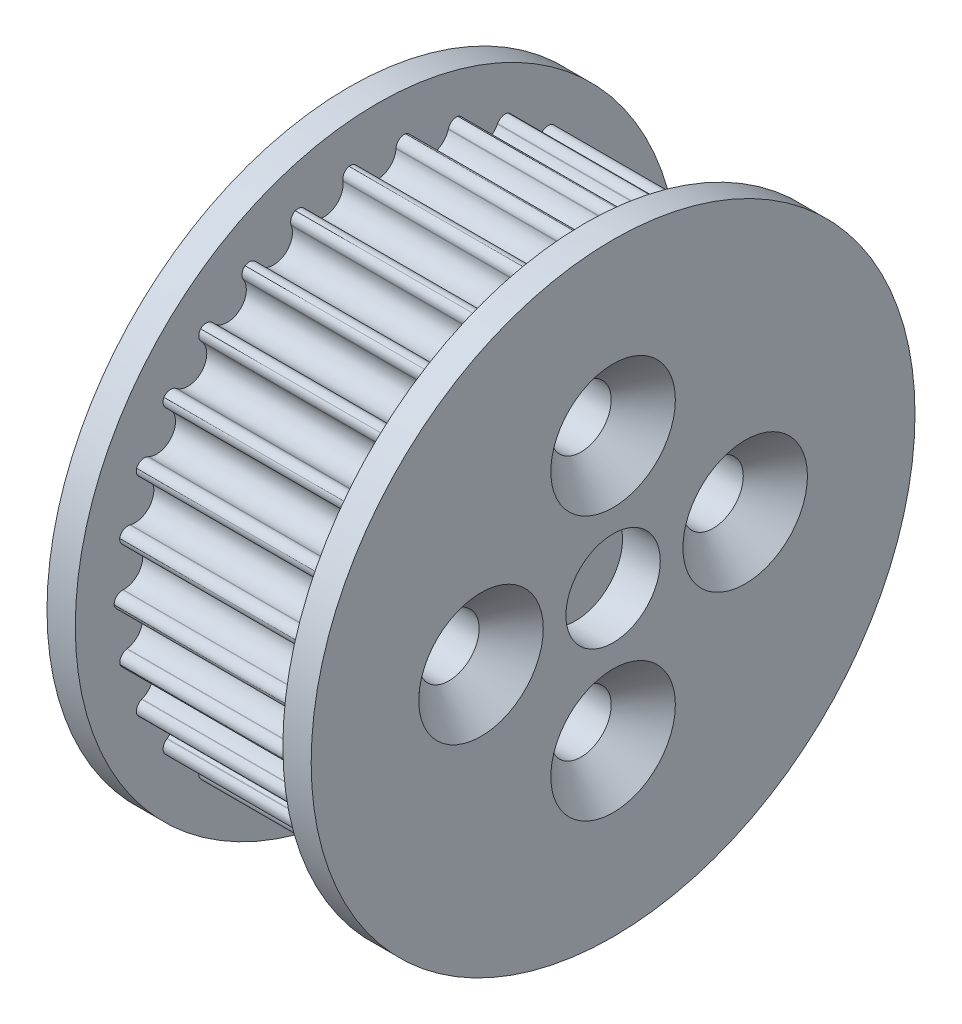
from build123d import *

# Parameters (mm, degrees)
SKETCH_1_R                     = 16
EXTRUDE_1_DEPTH                = 1.5
SKETCH_2_R                     = 13.945
EXTRUDE_2_DEPTH                = 11
CUT_EXTRUDE_START              = -11
CUT_EXTRUDE_1_DEPTH            = 11
FILLET_1_R                     = 0.45
PATTERN_START                  = 1.5
PATTERN_CIRCULAR_1_DEPTH       = 11
SKETCH_4_R                     = 16
EXTRUDE_3_DEPTH                = 1.5
HOLE_WIZARD_M3_1_D             = 3.2
SKETCH_7_R                     = 3
CUT_EXTRUDE_2_DEPTH            = 4
SKETCH_8_R                     = 2.5
CUT_EXTRUDE_3_DEPTH            = 2
HOLE_WIZARD_M3_1_2_D           = 3.2
HOLE_WIZARD_M3_1_2_CSINK_D     = 6.6
HOLE_WIZARD_M3_1_2_CSINK_ANGLE = 90


# Read off the part's stored shape, not the designer's step: 阵列(圆周)1
with BuildPart() as part:
    # 草图1 → 凸台-拉伸1 (new body)
    with BuildSketch(Plane(origin=(0, 0, 0), x_dir=(0, 0, -1), z_dir=(1, 0, 0))):
        Circle(SKETCH_1_R)
    extrude(amount=EXTRUDE_1_DEPTH)

    # 草图2 → 凸台-拉伸2 (add)
    with BuildSketch(Plane(origin=(1.5, 0, 0), x_dir=(0, 0, -1), z_dir=(1, 0, 0))):
        Circle(SKETCH_2_R)
    extrude(amount=EXTRUDE_2_DEPTH)

    # 草图3 → 切除-拉伸1 (cut)
    with BuildSketch(Plane(origin=(12.5, 0, 0), x_dir=(0, 0, -1), z_dir=(1, 0, 0)).offset(CUT_EXTRUDE_START)):
        with BuildLine():
            Line((-0.997252742, 13.425925926), (-1.032962963, 13.906689488))
            ThreePointArc((-1.032962963, 13.906689488), (0, 13.945), (1.032962963, 13.906689488))
            Line((1.032962963, 13.906689488), (0.997252742, 13.425925926))
            ThreePointArc((0.997252742, 13.425925926), (0, 12.5), (-0.997252742, 13.425925926))
        make_face()
    extrude(amount=CUT_EXTRUDE_1_DEPTH, mode=Mode.SUBTRACT)

    # 圆角1
    fillet_1_edges = [part.edges().sort_by_distance(p)[0] for p in [
        (7, 13.906689488, 1.032962963),
        (7, 13.906689488, -1.032962963),
    ]]
    fillet(fillet_1_edges, radius=FILLET_1_R)

    # 阵列(圆周)1 outline → 阵列(圆周)1 (cut)
    with BuildSketch(Plane.YZ.offset(PATTERN_START)):
        with BuildLine():
            Line((12.948797983, 3.773745592), (12.925196728, 3.766867337))
            ThreePointArc((12.925196728, 3.766867337), (12.226845009, 2.598896135), (13.339877736, 1.815946583))
            Line((13.339877736, 1.815946583), (13.37062966, 1.820132817))
            ThreePointArc((13.37062966, 1.820132817), (13.678173697, 1.750499408), (13.864510817, 1.496116577))
            ThreePointArc((13.864510817, 1.496116577), (13.632172809, 2.937156703), (13.250477864, 4.346016726))
            ThreePointArc((13.250477864, 4.346016726), (13.220964034, 3.995922584), (12.948797983, 3.773745592))
        make_face()
        with BuildLine():
            ThreePointArc((12.954992704, -3.775550956), (13.207625703, -3.96425367), (13.274386313, -4.272434084))
            ThreePointArc((13.274386313, -4.272434084), (13.640268293, -2.899328528), (13.864510817, -1.496116577))
            ThreePointArc((13.864510817, -1.496116577), (13.678173697, -1.750499408), (13.37062966, -1.820132817))
            Line((13.37062966, -1.820132817), (13.339877736, -1.815946583))
            ThreePointArc((13.339877736, -1.815946583), (12.226845009, -2.598896135), (12.925196728, -3.766867337))
            Line((12.925196728, -3.766867337), (12.954992704, -3.775550956))
        make_face()
        with BuildLine():
            ThreePointArc((11.886913848, -6.386540547), (12.094792709, -6.623645008), (12.096020129, -6.938971252))
            ThreePointArc((12.096020129, -6.938971252), (12.755076867, -5.636580446), (13.274386314, -4.272434084))
            ThreePointArc((13.274386314, -4.272434084), (13.04472895, -4.538318402), (12.69394963, -4.558088173))
            Line((12.69394963, -4.558088173), (12.670812877, -4.549780329))
            ThreePointArc((12.670812877, -4.549780329), (11.419318221, -5.084208039), (11.859574412, -6.371851754))
            Line((11.859574412, -6.371851754), (11.886913848, -6.386540547))
        make_face()
        with BuildLine():
            ThreePointArc((10.299319817, -8.71840767), (10.453359237, -8.993551275), (10.388999822, -9.302242079))
            ThreePointArc((10.388999822, -9.302242079), (11.304436864, -8.165337237), (12.096020129, -6.938971252))
            ThreePointArc((12.096020129, -6.938971252), (11.816100872, -7.151296908), (11.468876555, -7.097703541))
            Line((11.468876555, -7.097703541), (11.447972694, -7.084766842))
            ThreePointArc((11.447972694, -7.084766842), (10.11271243, -7.347315654), (10.275631785, -8.698355674))
            Line((10.275631785, -8.698355674), (10.299319817, -8.71840767))
        make_face()
        with BuildLine():
            ThreePointArc((8.261596088, -10.669238542), (8.355063805, -10.970396196), (8.227930371, -11.25896029))
            ThreePointArc((8.227930371, -11.25896029), (9.359738725, -10.33722961), (10.388999822, -9.302242079))
            ThreePointArc((10.388999822, -9.302242079), (10.071052486, -9.451729424), (9.742558541, -9.327115206))
            Line((9.742558541, -9.327115206), (9.724801171, -9.310115047))
            ThreePointArc((9.724801171, -9.310115047), (8.364132579, -9.289310318), (8.242594741, -10.644699711))
            Line((8.242594741, -10.644699711), (8.261596088, -10.669238542))
        make_face()
        with BuildLine():
            ThreePointArc((5.862800967, -12.153772493), (5.891611993, -12.467782161), (5.707260881, -12.72360791))
            ThreePointArc((5.707260881, -12.72360791), (7.005975091, -12.057335445), (8.227930371, -11.25896029))
            ThreePointArc((8.227930371, -11.25896029), (7.88585078, -11.339076009), (7.590443969, -11.14888718))
            Line((7.590443969, -11.14888718), (7.576609172, -11.12856655))
            ThreePointArc((7.576609172, -11.12856655), (6.25, -10.825317547), (5.849316754, -12.125819292))
            Line((5.849316754, -12.125819292), (5.862800967, -12.153772493))
        make_face()
        with BuildLine():
            ThreePointArc((3.20777331, -13.107128265), (3.170668466, -13.420266218), (2.937156703, -13.632172809))
            ThreePointArc((2.937156703, -13.632172809), (4.346016726, -13.250477864), (5.707260881, -12.72360791))
            ThreePointArc((5.707260881, -12.72360791), (5.355999555, -12.730850562), (5.106590573, -12.483399285))
            Line((5.106590573, -12.483399285), (5.097282995, -12.460646294))
            ThreePointArc((5.097282995, -12.460646294), (3.86271243, -11.888206454), (3.200395558, -13.076982384))
            Line((3.200395558, -13.076982384), (3.20777331, -13.107128265))
        make_face()
        with BuildLine():
            ThreePointArc((0.412550568, -13.487639638), (0.311151512, -13.786220244), (0.038684684, -13.944946343))
            ThreePointArc((0.038684684, -13.944946343), (1.496116577, -13.864510817), (2.937156703, -13.632172809))
            ThreePointArc((2.937156703, -13.632172809), (2.592065448, -13.566225856), (2.399554664, -13.27232694))
            Line((2.399554664, -13.27232694), (2.395181092, -13.248136002))
            ThreePointArc((2.395181092, -13.248136002), (1.30660579, -12.431523692), (0.411601718, -13.456618596))
            Line((0.411601718, -13.456618596), (0.412550568, -13.487639638))
        make_face()
        with BuildLine():
            ThreePointArc((-2.400702614, -13.278676438), (-2.561964256, -13.549650292), (-2.861478041, -13.648258805))
            ThreePointArc((-2.861478041, -13.648258805), (-1.419171046, -13.872598118), (0.038684684, -13.944946343))
            ThreePointArc((0.038684684, -13.944946343), (-0.285154357, -13.808691982), (-0.412353298, -13.48119022))
            Line((-0.412353298, -13.48119022), (-0.411601718, -13.456618596))
            ThreePointArc((-0.411601718, -13.456618596), (-1.30660579, -12.431523692), (-2.395181092, -13.248136002))
            Line((-2.395181092, -13.248136002), (-2.400702614, -13.278676438))
        make_face()
        with BuildLine():
            ThreePointArc((-5.109033572, -12.489371359), (-5.323109893, -12.720895603), (-5.636580446, -12.755076867))
            ThreePointArc((-5.636580446, -12.755076867), (-4.272434084, -13.274386313), (-2.861478041, -13.648258806))
            ThreePointArc((-2.861478041, -13.648258806), (-3.149911548, -13.447652008), (-3.206239442, -13.100860798))
            Line((-3.206239442, -13.100860798), (-3.200395558, -13.076982384))
            ThreePointArc((-3.200395558, -13.076982384), (-3.86271243, -11.888206454), (-5.097282995, -12.460646294))
            Line((-5.097282995, -12.460646294), (-5.109033572, -12.489371359))
        make_face()
        with BuildLine():
            ThreePointArc((-7.594075247, -11.154220821), (-7.851610083, -11.336176735), (-8.165337237, -11.304436864))
            ThreePointArc((-8.165337237, -11.304436864), (-6.938971252, -12.096020129), (-5.636580446, -12.755076867))
            ThreePointArc((-5.636580446, -12.755076867), (-5.877002489, -12.498885111), (-5.859997537, -12.147960893))
            Line((-5.859997537, -12.147960893), (-5.849316754, -12.125819292))
            ThreePointArc((-5.849316754, -12.125819292), (-6.25, -10.825317547), (-7.576609172, -11.12856655))
            Line((-7.576609172, -11.12856655), (-7.594075247, -11.154220821))
        make_face()
        with BuildLine():
            ThreePointArc((-9.747219393, -9.331577309), (-10.036957237, -9.456012547), (-10.33722961, -9.359738725))
            ThreePointArc((-10.33722961, -9.359738725), (-9.302242079, -10.388999822), (-8.165337237, -11.304436864))
            ThreePointArc((-8.165337237, -11.304436864), (-8.347240221, -11.003856959), (-8.25764562, -10.664136806))
            Line((-8.25764562, -10.664136806), (-8.242594741, -10.644699711))
            ThreePointArc((-8.242594741, -10.644699711), (-8.364132579, -9.289310318), (-9.724801171, -9.310115047))
            Line((-9.724801171, -9.310115047), (-9.747219393, -9.331577309))
        make_face()
        with BuildLine():
            ThreePointArc((-11.47436328, -7.101099091), (-11.783641197, -7.162575236), (-12.057335445, -7.005975091))
            ThreePointArc((-12.057335445, -7.005975091), (-11.25896029, -8.227930371), (-10.33722961, -9.359738725))
            ThreePointArc((-10.33722961, -9.359738725), (-10.452663501, -9.027907455), (-10.294394966, -8.714238767))
            Line((-10.294394966, -8.714238767), (-10.275631785, -8.698355674))
            ThreePointArc((-10.275631785, -8.698355674), (-10.11271243, -7.347315654), (-11.447972694, -7.084766842))
            Line((-11.447972694, -7.084766842), (-11.47436328, -7.101099091))
        make_face()
        with BuildLine():
            ThreePointArc((-12.700022431, -4.560268768), (-13.015323493, -4.556099016), (-13.250477864, -4.346016726))
            ThreePointArc((-13.250477864, -4.346016726), (-12.72360791, -5.707260881), (-12.057335445, -7.005975091))
            ThreePointArc((-12.057335445, -7.005975091), (-12.101255228, -6.657395075), (-11.881229853, -6.383486679))
            Line((-11.881229853, -6.383486679), (-11.859574412, -6.371851754))
            ThreePointArc((-11.859574412, -6.371851754), (-11.419318221, -5.084208039), (-12.670812877, -4.549780329))
            Line((-12.670812877, -4.549780329), (-12.700022431, -4.560268768))
        make_face()
        with BuildLine():
            ThreePointArc((-13.37062966, -1.820132817), (-13.678173697, -1.750499408), (-13.864510817, -1.496116577))
            ThreePointArc((-13.864510817, -1.496116577), (-13.632172809, -2.937156703), (-13.250477864, -4.346016726))
            ThreePointArc((-13.250477864, -4.346016726), (-13.220964034, -3.995922584), (-12.948797983, -3.773745592))
            Line((-12.948797983, -3.773745592), (-12.925196728, -3.766867337))
            ThreePointArc((-12.925196728, -3.766867337), (-12.226845009, -2.598896135), (-13.339877736, -1.815946583))
            Line((-13.339877736, -1.815946583), (-13.37062966, -1.820132817))
        make_face()
        with BuildLine():
            ThreePointArc((-13.456876214, 0.999551672), (-13.743222076, 1.131605425), (-13.872598118, 1.419171046))
            ThreePointArc((-13.872598118, 1.419171046), (-13.944946343, -0.038684684), (-13.864510817, -1.496116577))
            ThreePointArc((-13.864510817, -1.496116577), (-13.76285327, -1.159809102), (-13.450441506, -0.999073714))
            Line((-13.450441506, -0.999073714), (-13.425925926, -0.997252742))
            ThreePointArc((-13.425925926, -0.997252742), (-12.5, 0), (-13.425925926, 0.997252742))
            Line((-13.425925926, 0.997252742), (-13.456876214, 0.999551672))
        make_face()
        with BuildLine():
            ThreePointArc((-12.954992704, 3.775550956), (-13.207625703, 3.96425367), (-13.274386313, 4.272434084))
            ThreePointArc((-13.274386313, 4.272434084), (-13.648258805, 2.861478041), (-13.872598118, 1.419171046))
            ThreePointArc((-13.872598118, 1.419171046), (-13.703239776, 1.726993604), (-13.364236193, 1.81926248))
            Line((-13.364236193, 1.81926248), (-13.339877736, 1.815946583))
            ThreePointArc((-13.339877736, 1.815946583), (-12.226845009, 2.598896135), (-12.925196728, 3.766867337))
            Line((-12.925196728, 3.766867337), (-12.954992704, 3.775550956))
        make_face()
        with BuildLine():
            ThreePointArc((-11.886913848, 6.386540547), (-12.094792709, 6.623645008), (-12.096020129, 6.938971252))
            ThreePointArc((-12.096020129, 6.938971252), (-12.755076867, 5.636580446), (-13.274386313, 4.272434084))
            ThreePointArc((-13.274386313, 4.272434084), (-13.04472895, 4.538318402), (-12.69394963, 4.558088173))
            Line((-12.69394963, 4.558088173), (-12.670812877, 4.549780329))
            ThreePointArc((-12.670812877, 4.549780329), (-11.419318221, 5.084208039), (-11.859574412, 6.371851754))
            Line((-11.859574412, 6.371851754), (-11.886913848, 6.386540547))
        make_face()
        with BuildLine():
            ThreePointArc((-10.299319817, 8.71840767), (-10.453359237, 8.993551275), (-10.388999822, 9.302242079))
            ThreePointArc((-10.388999822, 9.302242079), (-11.304436864, 8.165337237), (-12.096020129, 6.938971252))
            ThreePointArc((-12.096020129, 6.938971252), (-11.816100872, 7.151296908), (-11.468876555, 7.097703541))
            Line((-11.468876555, 7.097703541), (-11.447972694, 7.084766842))
            ThreePointArc((-11.447972694, 7.084766842), (-10.11271243, 7.347315654), (-10.275631785, 8.698355674))
            Line((-10.275631785, 8.698355674), (-10.299319817, 8.71840767))
        make_face()
        with BuildLine():
            ThreePointArc((-8.261596088, 10.669238542), (-8.355063805, 10.970396196), (-8.227930371, 11.25896029))
            ThreePointArc((-8.227930371, 11.25896029), (-9.359738725, 10.33722961), (-10.388999822, 9.302242079))
            ThreePointArc((-10.388999822, 9.302242079), (-10.071052486, 9.451729424), (-9.742558541, 9.327115206))
            Line((-9.742558541, 9.327115206), (-9.724801171, 9.310115047))
            ThreePointArc((-9.724801171, 9.310115047), (-8.364132579, 9.289310318), (-8.242594741, 10.644699711))
            Line((-8.242594741, 10.644699711), (-8.261596088, 10.669238542))
        make_face()
        with BuildLine():
            ThreePointArc((-5.862800967, 12.153772493), (-5.891611993, 12.467782161), (-5.707260881, 12.72360791))
            ThreePointArc((-5.707260881, 12.72360791), (-7.005975091, 12.057335445), (-8.227930371, 11.25896029))
            ThreePointArc((-8.227930371, 11.25896029), (-7.88585078, 11.339076009), (-7.590443969, 11.14888718))
            Line((-7.590443969, 11.14888718), (-7.576609172, 11.12856655))
            ThreePointArc((-7.576609172, 11.12856655), (-6.25, 10.825317547), (-5.849316754, 12.125819292))
            Line((-5.849316754, 12.125819292), (-5.862800967, 12.153772493))
        make_face()
        with BuildLine():
            ThreePointArc((-3.20777331, 13.107128265), (-3.170668466, 13.420266218), (-2.937156703, 13.632172809))
            ThreePointArc((-2.937156703, 13.632172809), (-4.346016726, 13.250477864), (-5.707260881, 12.72360791))
            ThreePointArc((-5.707260881, 12.72360791), (-5.355999555, 12.730850562), (-5.106590573, 12.483399285))
            Line((-5.106590573, 12.483399285), (-5.097282995, 12.460646294))
            ThreePointArc((-5.097282995, 12.460646294), (-3.86271243, 11.888206454), (-3.200395558, 13.076982384))
            Line((-3.200395558, 13.076982384), (-3.20777331, 13.107128265))
        make_face()
        with BuildLine():
            ThreePointArc((-0.412550568, 13.487639638), (-0.311151512, 13.786220244), (-0.038684684, 13.944946343))
            ThreePointArc((-0.038684684, 13.944946343), (-1.496116577, 13.864510817), (-2.937156703, 13.632172809))
            ThreePointArc((-2.937156703, 13.632172809), (-2.592065448, 13.566225856), (-2.399554664, 13.27232694))
            Line((-2.399554664, 13.27232694), (-2.395181092, 13.248136002))
            ThreePointArc((-2.395181092, 13.248136002), (-1.30660579, 12.431523692), (-0.411601718, 13.456618596))
            Line((-0.411601718, 13.456618596), (-0.412550568, 13.487639638))
        make_face()
        with BuildLine():
            ThreePointArc((2.400702614, 13.278676438), (2.561964256, 13.549650292), (2.861478041, 13.648258805))
            ThreePointArc((2.861478041, 13.648258805), (1.419171046, 13.872598118), (-0.038684684, 13.944946343))
            ThreePointArc((-0.038684684, 13.944946343), (0.285154357, 13.808691982), (0.412353298, 13.48119022))
            Line((0.412353298, 13.48119022), (0.411601718, 13.456618596))
            ThreePointArc((0.411601718, 13.456618596), (1.30660579, 12.431523692), (2.395181092, 13.248136002))
            Line((2.395181092, 13.248136002), (2.400702614, 13.278676438))
        make_face()
        with BuildLine():
            ThreePointArc((5.109033572, 12.489371359), (5.323109893, 12.720895603), (5.636580446, 12.755076867))
            ThreePointArc((5.636580446, 12.755076867), (4.272434084, 13.274386313), (2.861478041, 13.648258806))
            ThreePointArc((2.861478041, 13.648258806), (3.149911548, 13.447652008), (3.206239442, 13.100860798))
            Line((3.206239442, 13.100860798), (3.200395558, 13.076982384))
            ThreePointArc((3.200395558, 13.076982384), (3.86271243, 11.888206454), (5.097282995, 12.460646294))
            Line((5.097282995, 12.460646294), (5.109033572, 12.489371359))
        make_face()
        with BuildLine():
            ThreePointArc((7.594075247, 11.154220821), (7.851610083, 11.336176735), (8.165337237, 11.304436864))
            ThreePointArc((8.165337237, 11.304436864), (6.938971252, 12.096020129), (5.636580446, 12.755076867))
            ThreePointArc((5.636580446, 12.755076867), (5.877002489, 12.498885111), (5.859997537, 12.147960893))
            Line((5.859997537, 12.147960893), (5.849316754, 12.125819292))
            ThreePointArc((5.849316754, 12.125819292), (6.25, 10.825317547), (7.576609172, 11.12856655))
            Line((7.576609172, 11.12856655), (7.594075247, 11.154220821))
        make_face()
        with BuildLine():
            ThreePointArc((9.747219393, 9.331577309), (10.036957237, 9.456012547), (10.33722961, 9.359738725))
            ThreePointArc((10.33722961, 9.359738725), (9.302242079, 10.388999822), (8.165337237, 11.304436864))
            ThreePointArc((8.165337237, 11.304436864), (8.347240221, 11.003856959), (8.25764562, 10.664136806))
            Line((8.25764562, 10.664136806), (8.242594741, 10.644699711))
            ThreePointArc((8.242594741, 10.644699711), (8.364132579, 9.289310318), (9.724801171, 9.310115047))
            Line((9.724801171, 9.310115047), (9.747219393, 9.331577309))
        make_face()
        with BuildLine():
            ThreePointArc((11.47436328, 7.101099091), (11.783641197, 7.162575236), (12.057335445, 7.005975091))
            ThreePointArc((12.057335445, 7.005975091), (11.25896029, 8.227930371), (10.33722961, 9.359738725))
            ThreePointArc((10.33722961, 9.359738725), (10.452663501, 9.027907455), (10.294394966, 8.714238767))
            Line((10.294394966, 8.714238767), (10.275631785, 8.698355674))
            ThreePointArc((10.275631785, 8.698355674), (10.11271243, 7.347315654), (11.447972694, 7.084766842))
            Line((11.447972694, 7.084766842), (11.47436328, 7.101099091))
        make_face()
        with BuildLine():
            ThreePointArc((12.700022431, 4.560268768), (13.015323493, 4.556099016), (13.250477864, 4.346016726))
            ThreePointArc((13.250477864, 4.346016726), (12.72360791, 5.707260881), (12.057335445, 7.005975091))
            ThreePointArc((12.057335445, 7.005975091), (12.101255228, 6.657395075), (11.881229853, 6.383486679))
            Line((11.881229853, 6.383486679), (11.859574412, 6.371851754))
            ThreePointArc((11.859574412, 6.371851754), (11.419318221, 5.084208039), (12.670812877, 4.549780329))
            Line((12.670812877, 4.549780329), (12.700022431, 4.560268768))
        make_face()
    extrude(amount=PATTERN_CIRCULAR_1_DEPTH, mode=Mode.SUBTRACT)

    # 草图4 → 凸台-拉伸3 (add)
    with BuildSketch(Plane(origin=(12.5, 0, 0), x_dir=(0, 0, -1), z_dir=(1, 0, 0))):
        Circle(SKETCH_4_R)
    extrude(amount=EXTRUDE_3_DEPTH)

    # Hole Wizard M3 _1 (through all)
    with Locations(Plane(origin=(14, 0, 0), x_dir=(0, 0, -1), z_dir=(1, 0, 0))):
        with Locations((0, -7), (0, 7), (-7, 0), (7, 0)):
            Hole(HOLE_WIZARD_M3_1_D / 2)

    # 草图7 → 切除-拉伸2 (cut)
    with BuildSketch(Plane.ZY):
        Circle(SKETCH_7_R)
    extrude(amount=-CUT_EXTRUDE_2_DEPTH, mode=Mode.SUBTRACT)

    # 草图8 → 切除-拉伸3 (cut)
    with BuildSketch(Plane(origin=(14, 0, 0), x_dir=(0, 0, -1), z_dir=(1, 0, 0))):
        Circle(SKETCH_8_R)
    extrude(amount=-CUT_EXTRUDE_3_DEPTH, mode=Mode.SUBTRACT)

    # Hole Wizard M3 _1 2 (through all)
    with Locations(Plane(origin=(14, 0, 0), x_dir=(0, 0, -1), z_dir=(1, 0, 0))):
        with Locations((0, 7), (-7, 0), (7, 0), (0, -7)):
            CounterSinkHole(HOLE_WIZARD_M3_1_2_D / 2, HOLE_WIZARD_M3_1_2_CSINK_D / 2, counter_sink_angle=HOLE_WIZARD_M3_1_2_CSINK_ANGLE)


solid = part.part
